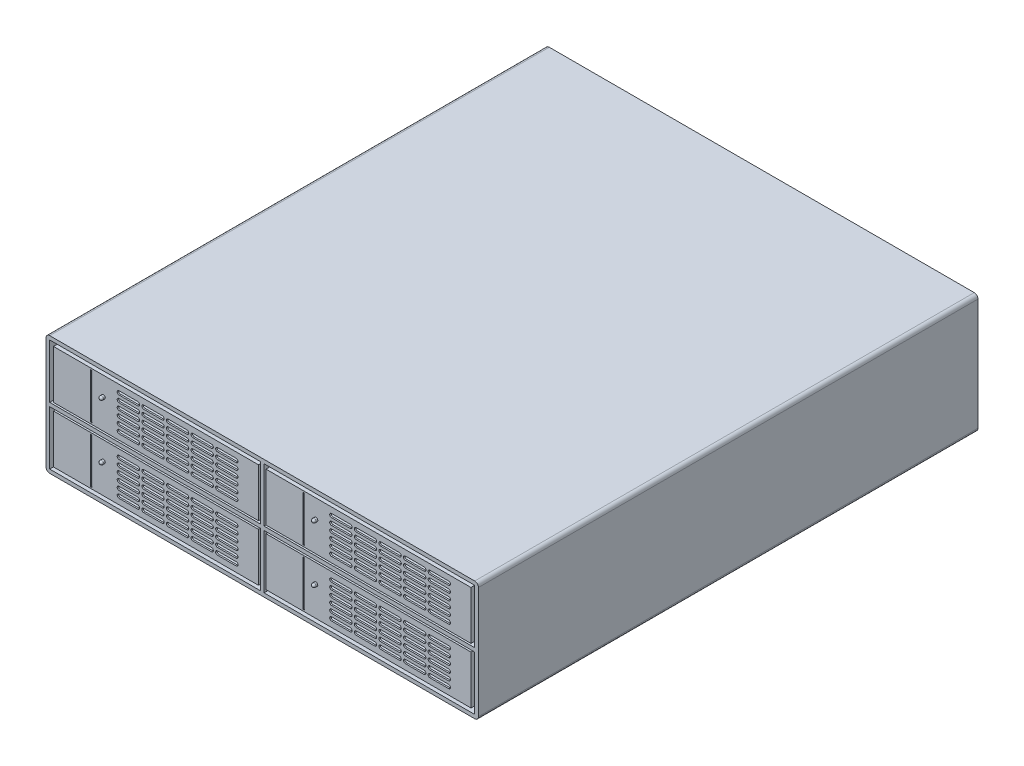
from build123d import *

# Parameters (mm, degrees)
SKETCH1_W           = 147.32
SKETCH1_H           = 40.64
BOSS_EXTRUDE1_DEPTH = 170.18
SKETCH2_W           = 71.755
SKETCH2_H           = 18.415
SKETCH2_W_2         = 69.85
SKETCH2_H_2         = 16.51
CUT_EXTRUDE1_DEPTH  = 152.4
FILLET1_R           = 1.27
CUT_EXTRUDE2_DEPTH  = 152.4
CUT_EXTRUDE3_START  = -0.508
SKETCH5_W           = 68.834
SKETCH5_H           = 15.494
CUT_EXTRUDE3_DEPTH  = 152.4
CUT_EXTRUDE4_START  = -0.508
SKETCH6_W           = 68.834
SKETCH6_H           = 15.494
CUT_EXTRUDE4_DEPTH  = 152.4
CUT_EXTRUDE5_START  = -0.508
SKETCH7_W           = 68.834
SKETCH7_H           = 15.494
CUT_EXTRUDE5_DEPTH  = 152.4
CUT_EXTRUDE6_START  = -0.508
SKETCH8_W           = 68.834
SKETCH8_H           = 15.494
CUT_EXTRUDE6_DEPTH  = 152.4
SKETCH9_W           = 0.508
SKETCH9_H           = 15.494
CUT_EXTRUDE7_DEPTH  = 0.254
SKETCH10_R          = 0.635
BOSS_EXTRUDE2_DEPTH = 1.27
FILLET3_R           = 0.635


with BuildPart() as part:
    # Sketch1 → Boss-Extrude1 (new body)
    with BuildSketch(Plane.XY):
        Rectangle(SKETCH1_W, SKETCH1_H)
    extrude(amount=-BOSS_EXTRUDE1_DEPTH)

    # Sketch2 → Cut-Extrude1 (cut)
    # profile 1 of 4: a face of its own
    with BuildSketch(Plane.XY):
        with Locations((-36.5125, 9.8425)):
            Rectangle(SKETCH2_W, SKETCH2_H)
        with Locations((-36.195, 9.525)):
            Rectangle(SKETCH2_W_2, SKETCH2_H_2, mode=Mode.SUBTRACT)
    # profile 2 of 4: a face of its own
    with BuildSketch(Plane.XY):
        with Locations((-36.5125, -9.8425)):
            Rectangle(SKETCH2_W, SKETCH2_H)
        with Locations((-36.195, -9.525)):
            Rectangle(SKETCH2_W_2, SKETCH2_H_2, mode=Mode.SUBTRACT)
    # profile 3 of 4: a face of its own
    with BuildSketch(Plane.XY):
        with Locations((36.5125, -9.8425)):
            Rectangle(SKETCH2_W, SKETCH2_H)
        with Locations((36.195, -9.525)):
            Rectangle(SKETCH2_W_2, SKETCH2_H_2, mode=Mode.SUBTRACT)
    # profile 4 of 4: a face of its own
    with BuildSketch(Plane.XY):
        with Locations((36.5125, 9.8425)):
            Rectangle(SKETCH2_W, SKETCH2_H)
        with Locations((36.195, 9.525)):
            Rectangle(SKETCH2_W_2, SKETCH2_H_2, mode=Mode.SUBTRACT)
    extrude(amount=-CUT_EXTRUDE1_DEPTH, mode=Mode.SUBTRACT)

    # Fillet1
    fillet1_edges = [part.edges().sort_by_distance(p)[0] for p in [
        (-73.66, 20.32, -85.09),
        (-73.66, -20.32, -85.09),
        (73.66, -20.32, -85.09),
        (73.66, 20.32, -85.09),
    ]]
    fillet(fillet1_edges, radius=FILLET1_R)

    # Sketch4 → Cut-Extrude2 (cut)
    with BuildSketch(Plane.XY):
        with BuildLine():
            Line((-8.89, 3.175), (-15.24, 3.175))
            ThreePointArc((-15.24, 3.175), (-15.875, 3.81), (-15.24, 4.445))
            Line((-15.24, 4.445), (-8.89, 4.445))
            ThreePointArc((-8.89, 4.445), (-8.255, 3.81), (-8.89, 3.175))
        make_face()
        with BuildLine():
            Line((-8.89, 5.461), (-15.24, 5.461))
            ThreePointArc((-15.24, 5.461), (-15.875, 6.096), (-15.24, 6.731))
            Line((-15.24, 6.731), (-8.89, 6.731))
            ThreePointArc((-8.89, 6.731), (-8.255, 6.096), (-8.89, 5.461))
        make_face()
        with BuildLine():
            Line((-8.89, 7.747), (-15.24, 7.747))
            ThreePointArc((-15.24, 7.747), (-15.875, 8.382), (-15.24, 9.017))
            Line((-15.24, 9.017), (-8.89, 9.017))
            ThreePointArc((-8.89, 9.017), (-8.255, 8.382), (-8.89, 7.747))
        make_face()
        with BuildLine():
            Line((-8.89, 10.033), (-15.24, 10.033))
            ThreePointArc((-15.24, 10.033), (-15.875, 10.668), (-15.24, 11.303))
            Line((-15.24, 11.303), (-8.89, 11.303))
            ThreePointArc((-8.89, 11.303), (-8.255, 10.668), (-8.89, 10.033))
        make_face()
        with BuildLine():
            Line((-8.89, 12.319), (-15.24, 12.319))
            ThreePointArc((-15.24, 12.319), (-15.875, 12.954), (-15.24, 13.589))
            Line((-15.24, 13.589), (-8.89, 13.589))
            ThreePointArc((-8.89, 13.589), (-8.255, 12.954), (-8.89, 12.319))
        make_face()
        with BuildLine():
            Line((-8.89, 14.605), (-15.24, 14.605))
            ThreePointArc((-15.24, 14.605), (-15.875, 15.24), (-15.24, 15.875))
            Line((-15.24, 15.875), (-8.89, 15.875))
            ThreePointArc((-8.89, 15.875), (-8.255, 15.24), (-8.89, 14.605))
        make_face()
        with BuildLine():
            Line((-17.272, 3.175), (-23.622, 3.175))
            ThreePointArc((-23.622, 3.175), (-24.257, 3.81), (-23.622, 4.445))
            Line((-23.622, 4.445), (-17.272, 4.445))
            ThreePointArc((-17.272, 4.445), (-16.637, 3.81), (-17.272, 3.175))
        make_face()
        with BuildLine():
            Line((-17.272, 5.461), (-23.622, 5.461))
            ThreePointArc((-23.622, 5.461), (-24.257, 6.096), (-23.622, 6.731))
            Line((-23.622, 6.731), (-17.272, 6.731))
            ThreePointArc((-17.272, 6.731), (-16.637, 6.096), (-17.272, 5.461))
        make_face()
        with BuildLine():
            Line((-17.272, 7.747), (-23.622, 7.747))
            ThreePointArc((-23.622, 7.747), (-24.257, 8.382), (-23.622, 9.017))
            Line((-23.622, 9.017), (-17.272, 9.017))
            ThreePointArc((-17.272, 9.017), (-16.637, 8.382), (-17.272, 7.747))
        make_face()
        with BuildLine():
            Line((-17.272, 10.033), (-23.622, 10.033))
            ThreePointArc((-23.622, 10.033), (-24.257, 10.668), (-23.622, 11.303))
            Line((-23.622, 11.303), (-17.272, 11.303))
            ThreePointArc((-17.272, 11.303), (-16.637, 10.668), (-17.272, 10.033))
        make_face()
        with BuildLine():
            Line((-17.272, 12.319), (-23.622, 12.319))
            ThreePointArc((-23.622, 12.319), (-24.257, 12.954), (-23.622, 13.589))
            Line((-23.622, 13.589), (-17.272, 13.589))
            ThreePointArc((-17.272, 13.589), (-16.637, 12.954), (-17.272, 12.319))
        make_face()
        with BuildLine():
            Line((-17.272, 14.605), (-23.622, 14.605))
            ThreePointArc((-23.622, 14.605), (-24.257, 15.24), (-23.622, 15.875))
            Line((-23.622, 15.875), (-17.272, 15.875))
            ThreePointArc((-17.272, 15.875), (-16.637, 15.24), (-17.272, 14.605))
        make_face()
        with BuildLine():
            Line((-25.654, 3.175), (-32.004, 3.175))
            ThreePointArc((-32.004, 3.175), (-32.639, 3.81), (-32.004, 4.445))
            Line((-32.004, 4.445), (-25.654, 4.445))
            ThreePointArc((-25.654, 4.445), (-25.019, 3.81), (-25.654, 3.175))
        make_face()
        with BuildLine():
            Line((-25.654, 5.461), (-32.004, 5.461))
            ThreePointArc((-32.004, 5.461), (-32.639, 6.096), (-32.004, 6.731))
            Line((-32.004, 6.731), (-25.654, 6.731))
            ThreePointArc((-25.654, 6.731), (-25.019, 6.096), (-25.654, 5.461))
        make_face()
        with BuildLine():
            Line((-25.654, 7.747), (-32.004, 7.747))
            ThreePointArc((-32.004, 7.747), (-32.639, 8.382), (-32.004, 9.017))
            Line((-32.004, 9.017), (-25.654, 9.017))
            ThreePointArc((-25.654, 9.017), (-25.019, 8.382), (-25.654, 7.747))
        make_face()
        with BuildLine():
            Line((-25.654, 10.033), (-32.004, 10.033))
            ThreePointArc((-32.004, 10.033), (-32.639, 10.668), (-32.004, 11.303))
            Line((-32.004, 11.303), (-25.654, 11.303))
            ThreePointArc((-25.654, 11.303), (-25.019, 10.668), (-25.654, 10.033))
        make_face()
        with BuildLine():
            Line((-25.654, 12.319), (-32.004, 12.319))
            ThreePointArc((-32.004, 12.319), (-32.639, 12.954), (-32.004, 13.589))
            Line((-32.004, 13.589), (-25.654, 13.589))
            ThreePointArc((-25.654, 13.589), (-25.019, 12.954), (-25.654, 12.319))
        make_face()
        with BuildLine():
            Line((-25.654, 14.605), (-32.004, 14.605))
            ThreePointArc((-32.004, 14.605), (-32.639, 15.24), (-32.004, 15.875))
            Line((-32.004, 15.875), (-25.654, 15.875))
            ThreePointArc((-25.654, 15.875), (-25.019, 15.24), (-25.654, 14.605))
        make_face()
        with BuildLine():
            Line((-34.036, 3.175), (-40.386, 3.175))
            ThreePointArc((-40.386, 3.175), (-41.021, 3.81), (-40.386, 4.445))
            Line((-40.386, 4.445), (-34.036, 4.445))
            ThreePointArc((-34.036, 4.445), (-33.401, 3.81), (-34.036, 3.175))
        make_face()
        with BuildLine():
            Line((-34.036, 5.461), (-40.386, 5.461))
            ThreePointArc((-40.386, 5.461), (-41.021, 6.096), (-40.386, 6.731))
            Line((-40.386, 6.731), (-34.036, 6.731))
            ThreePointArc((-34.036, 6.731), (-33.401, 6.096), (-34.036, 5.461))
        make_face()
        with BuildLine():
            Line((-34.036, 7.747), (-40.386, 7.747))
            ThreePointArc((-40.386, 7.747), (-41.021, 8.382), (-40.386, 9.017))
            Line((-40.386, 9.017), (-34.036, 9.017))
            ThreePointArc((-34.036, 9.017), (-33.401, 8.382), (-34.036, 7.747))
        make_face()
        with BuildLine():
            Line((-34.036, 10.033), (-40.386, 10.033))
            ThreePointArc((-40.386, 10.033), (-41.021, 10.668), (-40.386, 11.303))
            Line((-40.386, 11.303), (-34.036, 11.303))
            ThreePointArc((-34.036, 11.303), (-33.401, 10.668), (-34.036, 10.033))
        make_face()
        with BuildLine():
            Line((-34.036, 12.319), (-40.386, 12.319))
            ThreePointArc((-40.386, 12.319), (-41.021, 12.954), (-40.386, 13.589))
            Line((-40.386, 13.589), (-34.036, 13.589))
            ThreePointArc((-34.036, 13.589), (-33.401, 12.954), (-34.036, 12.319))
        make_face()
        with BuildLine():
            Line((-34.036, 14.605), (-40.386, 14.605))
            ThreePointArc((-40.386, 14.605), (-41.021, 15.24), (-40.386, 15.875))
            Line((-40.386, 15.875), (-34.036, 15.875))
            ThreePointArc((-34.036, 15.875), (-33.401, 15.24), (-34.036, 14.605))
        make_face()
        with BuildLine():
            Line((-42.418, 3.175), (-48.768, 3.175))
            ThreePointArc((-48.768, 3.175), (-49.403, 3.81), (-48.768, 4.445))
            Line((-48.768, 4.445), (-42.418, 4.445))
            ThreePointArc((-42.418, 4.445), (-41.783, 3.81), (-42.418, 3.175))
        make_face()
        with BuildLine():
            Line((-42.418, 5.461), (-48.768, 5.461))
            ThreePointArc((-48.768, 5.461), (-49.403, 6.096), (-48.768, 6.731))
            Line((-48.768, 6.731), (-42.418, 6.731))
            ThreePointArc((-42.418, 6.731), (-41.783, 6.096), (-42.418, 5.461))
        make_face()
        with BuildLine():
            Line((-42.418, 7.747), (-48.768, 7.747))
            ThreePointArc((-48.768, 7.747), (-49.403, 8.382), (-48.768, 9.017))
            Line((-48.768, 9.017), (-42.418, 9.017))
            ThreePointArc((-42.418, 9.017), (-41.783, 8.382), (-42.418, 7.747))
        make_face()
        with BuildLine():
            Line((-42.418, 10.033), (-48.768, 10.033))
            ThreePointArc((-48.768, 10.033), (-49.403, 10.668), (-48.768, 11.303))
            Line((-48.768, 11.303), (-42.418, 11.303))
            ThreePointArc((-42.418, 11.303), (-41.783, 10.668), (-42.418, 10.033))
        make_face()
        with BuildLine():
            Line((-42.418, 12.319), (-48.768, 12.319))
            ThreePointArc((-48.768, 12.319), (-49.403, 12.954), (-48.768, 13.589))
            Line((-48.768, 13.589), (-42.418, 13.589))
            ThreePointArc((-42.418, 13.589), (-41.783, 12.954), (-42.418, 12.319))
        make_face()
        with BuildLine():
            Line((-42.418, 14.605), (-48.768, 14.605))
            ThreePointArc((-48.768, 14.605), (-49.403, 15.24), (-48.768, 15.875))
            Line((-48.768, 15.875), (-42.418, 15.875))
            ThreePointArc((-42.418, 15.875), (-41.783, 15.24), (-42.418, 14.605))
        make_face()
        with BuildLine():
            Line((-42.418, -14.605), (-48.768, -14.605))
            ThreePointArc((-48.768, -14.605), (-49.403, -15.24), (-48.768, -15.875))
            Line((-48.768, -15.875), (-42.418, -15.875))
            ThreePointArc((-42.418, -15.875), (-41.783, -15.24), (-42.418, -14.605))
        make_face()
        with BuildLine():
            Line((-42.418, -12.319), (-48.768, -12.319))
            ThreePointArc((-48.768, -12.319), (-49.403, -12.954), (-48.768, -13.589))
            Line((-48.768, -13.589), (-42.418, -13.589))
            ThreePointArc((-42.418, -13.589), (-41.783, -12.954), (-42.418, -12.319))
        make_face()
        with BuildLine():
            Line((-42.418, -10.033), (-48.768, -10.033))
            ThreePointArc((-48.768, -10.033), (-49.403, -10.668), (-48.768, -11.303))
            Line((-48.768, -11.303), (-42.418, -11.303))
            ThreePointArc((-42.418, -11.303), (-41.783, -10.668), (-42.418, -10.033))
        make_face()
        with BuildLine():
            Line((-42.418, -7.747), (-48.768, -7.747))
            ThreePointArc((-48.768, -7.747), (-49.403, -8.382), (-48.768, -9.017))
            Line((-48.768, -9.017), (-42.418, -9.017))
            ThreePointArc((-42.418, -9.017), (-41.783, -8.382), (-42.418, -7.747))
        make_face()
        with BuildLine():
            Line((-42.418, -5.461), (-48.768, -5.461))
            ThreePointArc((-48.768, -5.461), (-49.403, -6.096), (-48.768, -6.731))
            Line((-48.768, -6.731), (-42.418, -6.731))
            ThreePointArc((-42.418, -6.731), (-41.783, -6.096), (-42.418, -5.461))
        make_face()
        with BuildLine():
            Line((-42.418, -3.175), (-48.768, -3.175))
            ThreePointArc((-48.768, -3.175), (-49.403, -3.81), (-48.768, -4.445))
            Line((-48.768, -4.445), (-42.418, -4.445))
            ThreePointArc((-42.418, -4.445), (-41.783, -3.81), (-42.418, -3.175))
        make_face()
        with BuildLine():
            Line((-34.036, -14.605), (-40.386, -14.605))
            ThreePointArc((-40.386, -14.605), (-41.021, -15.24), (-40.386, -15.875))
            Line((-40.386, -15.875), (-34.036, -15.875))
            ThreePointArc((-34.036, -15.875), (-33.401, -15.24), (-34.036, -14.605))
        make_face()
        with BuildLine():
            Line((-34.036, -12.319), (-40.386, -12.319))
            ThreePointArc((-40.386, -12.319), (-41.021, -12.954), (-40.386, -13.589))
            Line((-40.386, -13.589), (-34.036, -13.589))
            ThreePointArc((-34.036, -13.589), (-33.401, -12.954), (-34.036, -12.319))
        make_face()
        with BuildLine():
            Line((-34.036, -10.033), (-40.386, -10.033))
            ThreePointArc((-40.386, -10.033), (-41.021, -10.668), (-40.386, -11.303))
            Line((-40.386, -11.303), (-34.036, -11.303))
            ThreePointArc((-34.036, -11.303), (-33.401, -10.668), (-34.036, -10.033))
        make_face()
        with BuildLine():
            Line((-34.036, -7.747), (-40.386, -7.747))
            ThreePointArc((-40.386, -7.747), (-41.021, -8.382), (-40.386, -9.017))
            Line((-40.386, -9.017), (-34.036, -9.017))
            ThreePointArc((-34.036, -9.017), (-33.401, -8.382), (-34.036, -7.747))
        make_face()
        with BuildLine():
            Line((-34.036, -5.461), (-40.386, -5.461))
            ThreePointArc((-40.386, -5.461), (-41.021, -6.096), (-40.386, -6.731))
            Line((-40.386, -6.731), (-34.036, -6.731))
            ThreePointArc((-34.036, -6.731), (-33.401, -6.096), (-34.036, -5.461))
        make_face()
        with BuildLine():
            Line((-34.036, -3.175), (-40.386, -3.175))
            ThreePointArc((-40.386, -3.175), (-41.021, -3.81), (-40.386, -4.445))
            Line((-40.386, -4.445), (-34.036, -4.445))
            ThreePointArc((-34.036, -4.445), (-33.401, -3.81), (-34.036, -3.175))
        make_face()
        with BuildLine():
            Line((-25.654, -14.605), (-32.004, -14.605))
            ThreePointArc((-32.004, -14.605), (-32.639, -15.24), (-32.004, -15.875))
            Line((-32.004, -15.875), (-25.654, -15.875))
            ThreePointArc((-25.654, -15.875), (-25.019, -15.24), (-25.654, -14.605))
        make_face()
        with BuildLine():
            Line((-25.654, -12.319), (-32.004, -12.319))
            ThreePointArc((-32.004, -12.319), (-32.639, -12.954), (-32.004, -13.589))
            Line((-32.004, -13.589), (-25.654, -13.589))
            ThreePointArc((-25.654, -13.589), (-25.019, -12.954), (-25.654, -12.319))
        make_face()
        with BuildLine():
            Line((-25.654, -10.033), (-32.004, -10.033))
            ThreePointArc((-32.004, -10.033), (-32.639, -10.668), (-32.004, -11.303))
            Line((-32.004, -11.303), (-25.654, -11.303))
            ThreePointArc((-25.654, -11.303), (-25.019, -10.668), (-25.654, -10.033))
        make_face()
        with BuildLine():
            Line((-25.654, -7.747), (-32.004, -7.747))
            ThreePointArc((-32.004, -7.747), (-32.639, -8.382), (-32.004, -9.017))
            Line((-32.004, -9.017), (-25.654, -9.017))
            ThreePointArc((-25.654, -9.017), (-25.019, -8.382), (-25.654, -7.747))
        make_face()
        with BuildLine():
            Line((-25.654, -5.461), (-32.004, -5.461))
            ThreePointArc((-32.004, -5.461), (-32.639, -6.096), (-32.004, -6.731))
            Line((-32.004, -6.731), (-25.654, -6.731))
            ThreePointArc((-25.654, -6.731), (-25.019, -6.096), (-25.654, -5.461))
        make_face()
        with BuildLine():
            Line((-25.654, -3.175), (-32.004, -3.175))
            ThreePointArc((-32.004, -3.175), (-32.639, -3.81), (-32.004, -4.445))
            Line((-32.004, -4.445), (-25.654, -4.445))
            ThreePointArc((-25.654, -4.445), (-25.019, -3.81), (-25.654, -3.175))
        make_face()
        with BuildLine():
            Line((-17.272, -14.605), (-23.622, -14.605))
            ThreePointArc((-23.622, -14.605), (-24.257, -15.24), (-23.622, -15.875))
            Line((-23.622, -15.875), (-17.272, -15.875))
            ThreePointArc((-17.272, -15.875), (-16.637, -15.24), (-17.272, -14.605))
        make_face()
        with BuildLine():
            Line((-17.272, -12.319), (-23.622, -12.319))
            ThreePointArc((-23.622, -12.319), (-24.257, -12.954), (-23.622, -13.589))
            Line((-23.622, -13.589), (-17.272, -13.589))
            ThreePointArc((-17.272, -13.589), (-16.637, -12.954), (-17.272, -12.319))
        make_face()
        with BuildLine():
            Line((-17.272, -10.033), (-23.622, -10.033))
            ThreePointArc((-23.622, -10.033), (-24.257, -10.668), (-23.622, -11.303))
            Line((-23.622, -11.303), (-17.272, -11.303))
            ThreePointArc((-17.272, -11.303), (-16.637, -10.668), (-17.272, -10.033))
        make_face()
        with BuildLine():
            Line((-17.272, -7.747), (-23.622, -7.747))
            ThreePointArc((-23.622, -7.747), (-24.257, -8.382), (-23.622, -9.017))
            Line((-23.622, -9.017), (-17.272, -9.017))
            ThreePointArc((-17.272, -9.017), (-16.637, -8.382), (-17.272, -7.747))
        make_face()
        with BuildLine():
            Line((-17.272, -5.461), (-23.622, -5.461))
            ThreePointArc((-23.622, -5.461), (-24.257, -6.096), (-23.622, -6.731))
            Line((-23.622, -6.731), (-17.272, -6.731))
            ThreePointArc((-17.272, -6.731), (-16.637, -6.096), (-17.272, -5.461))
        make_face()
        with BuildLine():
            Line((-17.272, -3.175), (-23.622, -3.175))
            ThreePointArc((-23.622, -3.175), (-24.257, -3.81), (-23.622, -4.445))
            Line((-23.622, -4.445), (-17.272, -4.445))
            ThreePointArc((-17.272, -4.445), (-16.637, -3.81), (-17.272, -3.175))
        make_face()
        with BuildLine():
            Line((-8.89, -14.605), (-15.24, -14.605))
            ThreePointArc((-15.24, -14.605), (-15.875, -15.24), (-15.24, -15.875))
            Line((-15.24, -15.875), (-8.89, -15.875))
            ThreePointArc((-8.89, -15.875), (-8.255, -15.24), (-8.89, -14.605))
        make_face()
        with BuildLine():
            Line((-8.89, -12.319), (-15.24, -12.319))
            ThreePointArc((-15.24, -12.319), (-15.875, -12.954), (-15.24, -13.589))
            Line((-15.24, -13.589), (-8.89, -13.589))
            ThreePointArc((-8.89, -13.589), (-8.255, -12.954), (-8.89, -12.319))
        make_face()
        with BuildLine():
            Line((-8.89, -10.033), (-15.24, -10.033))
            ThreePointArc((-15.24, -10.033), (-15.875, -10.668), (-15.24, -11.303))
            Line((-15.24, -11.303), (-8.89, -11.303))
            ThreePointArc((-8.89, -11.303), (-8.255, -10.668), (-8.89, -10.033))
        make_face()
        with BuildLine():
            Line((-8.89, -7.747), (-15.24, -7.747))
            ThreePointArc((-15.24, -7.747), (-15.875, -8.382), (-15.24, -9.017))
            Line((-15.24, -9.017), (-8.89, -9.017))
            ThreePointArc((-8.89, -9.017), (-8.255, -8.382), (-8.89, -7.747))
        make_face()
        with BuildLine():
            Line((-8.89, -5.461), (-15.24, -5.461))
            ThreePointArc((-15.24, -5.461), (-15.875, -6.096), (-15.24, -6.731))
            Line((-15.24, -6.731), (-8.89, -6.731))
            ThreePointArc((-8.89, -6.731), (-8.255, -6.096), (-8.89, -5.461))
        make_face()
        with BuildLine():
            Line((-8.89, -3.175), (-15.24, -3.175))
            ThreePointArc((-15.24, -3.175), (-15.875, -3.81), (-15.24, -4.445))
            Line((-15.24, -4.445), (-8.89, -4.445))
            ThreePointArc((-8.89, -4.445), (-8.255, -3.81), (-8.89, -3.175))
        make_face()
        with BuildLine():
            Line((63.5, 3.175), (57.15, 3.175))
            ThreePointArc((57.15, 3.175), (56.515, 3.81), (57.15, 4.445))
            Line((57.15, 4.445), (63.5, 4.445))
            ThreePointArc((63.5, 4.445), (64.135, 3.81), (63.5, 3.175))
        make_face()
        with BuildLine():
            Line((63.5, 5.461), (57.15, 5.461))
            ThreePointArc((57.15, 5.461), (56.515, 6.096), (57.15, 6.731))
            Line((57.15, 6.731), (63.5, 6.731))
            ThreePointArc((63.5, 6.731), (64.135, 6.096), (63.5, 5.461))
        make_face()
        with BuildLine():
            Line((63.5, 7.747), (57.15, 7.747))
            ThreePointArc((57.15, 7.747), (56.515, 8.382), (57.15, 9.017))
            Line((57.15, 9.017), (63.5, 9.017))
            ThreePointArc((63.5, 9.017), (64.135, 8.382), (63.5, 7.747))
        make_face()
        with BuildLine():
            Line((63.5, 10.033), (57.15, 10.033))
            ThreePointArc((57.15, 10.033), (56.515, 10.668), (57.15, 11.303))
            Line((57.15, 11.303), (63.5, 11.303))
            ThreePointArc((63.5, 11.303), (64.135, 10.668), (63.5, 10.033))
        make_face()
        with BuildLine():
            Line((63.5, 12.319), (57.15, 12.319))
            ThreePointArc((57.15, 12.319), (56.515, 12.954), (57.15, 13.589))
            Line((57.15, 13.589), (63.5, 13.589))
            ThreePointArc((63.5, 13.589), (64.135, 12.954), (63.5, 12.319))
        make_face()
        with BuildLine():
            Line((63.5, 14.605), (57.15, 14.605))
            ThreePointArc((57.15, 14.605), (56.515, 15.24), (57.15, 15.875))
            Line((57.15, 15.875), (63.5, 15.875))
            ThreePointArc((63.5, 15.875), (64.135, 15.24), (63.5, 14.605))
        make_face()
        with BuildLine():
            Line((55.118, 3.175), (48.768, 3.175))
            ThreePointArc((48.768, 3.175), (48.133, 3.81), (48.768, 4.445))
            Line((48.768, 4.445), (55.118, 4.445))
            ThreePointArc((55.118, 4.445), (55.753, 3.81), (55.118, 3.175))
        make_face()
        with BuildLine():
            Line((55.118, 5.461), (48.768, 5.461))
            ThreePointArc((48.768, 5.461), (48.133, 6.096), (48.768, 6.731))
            Line((48.768, 6.731), (55.118, 6.731))
            ThreePointArc((55.118, 6.731), (55.753, 6.096), (55.118, 5.461))
        make_face()
        with BuildLine():
            Line((55.118, 7.747), (48.768, 7.747))
            ThreePointArc((48.768, 7.747), (48.133, 8.382), (48.768, 9.017))
            Line((48.768, 9.017), (55.118, 9.017))
            ThreePointArc((55.118, 9.017), (55.753, 8.382), (55.118, 7.747))
        make_face()
        with BuildLine():
            Line((55.118, 10.033), (48.768, 10.033))
            ThreePointArc((48.768, 10.033), (48.133, 10.668), (48.768, 11.303))
            Line((48.768, 11.303), (55.118, 11.303))
            ThreePointArc((55.118, 11.303), (55.753, 10.668), (55.118, 10.033))
        make_face()
        with BuildLine():
            Line((55.118, 12.319), (48.768, 12.319))
            ThreePointArc((48.768, 12.319), (48.133, 12.954), (48.768, 13.589))
            Line((48.768, 13.589), (55.118, 13.589))
            ThreePointArc((55.118, 13.589), (55.753, 12.954), (55.118, 12.319))
        make_face()
        with BuildLine():
            Line((55.118, 14.605), (48.768, 14.605))
            ThreePointArc((48.768, 14.605), (48.133, 15.24), (48.768, 15.875))
            Line((48.768, 15.875), (55.118, 15.875))
            ThreePointArc((55.118, 15.875), (55.753, 15.24), (55.118, 14.605))
        make_face()
        with BuildLine():
            Line((46.736, 3.175), (40.386, 3.175))
            ThreePointArc((40.386, 3.175), (39.751, 3.81), (40.386, 4.445))
            Line((40.386, 4.445), (46.736, 4.445))
            ThreePointArc((46.736, 4.445), (47.371, 3.81), (46.736, 3.175))
        make_face()
        with BuildLine():
            Line((46.736, 5.461), (40.386, 5.461))
            ThreePointArc((40.386, 5.461), (39.751, 6.096), (40.386, 6.731))
            Line((40.386, 6.731), (46.736, 6.731))
            ThreePointArc((46.736, 6.731), (47.371, 6.096), (46.736, 5.461))
        make_face()
        with BuildLine():
            Line((46.736, 7.747), (40.386, 7.747))
            ThreePointArc((40.386, 7.747), (39.751, 8.382), (40.386, 9.017))
            Line((40.386, 9.017), (46.736, 9.017))
            ThreePointArc((46.736, 9.017), (47.371, 8.382), (46.736, 7.747))
        make_face()
        with BuildLine():
            Line((46.736, 10.033), (40.386, 10.033))
            ThreePointArc((40.386, 10.033), (39.751, 10.668), (40.386, 11.303))
            Line((40.386, 11.303), (46.736, 11.303))
            ThreePointArc((46.736, 11.303), (47.371, 10.668), (46.736, 10.033))
        make_face()
        with BuildLine():
            Line((46.736, 12.319), (40.386, 12.319))
            ThreePointArc((40.386, 12.319), (39.751, 12.954), (40.386, 13.589))
            Line((40.386, 13.589), (46.736, 13.589))
            ThreePointArc((46.736, 13.589), (47.371, 12.954), (46.736, 12.319))
        make_face()
        with BuildLine():
            Line((46.736, 14.605), (40.386, 14.605))
            ThreePointArc((40.386, 14.605), (39.751, 15.24), (40.386, 15.875))
            Line((40.386, 15.875), (46.736, 15.875))
            ThreePointArc((46.736, 15.875), (47.371, 15.24), (46.736, 14.605))
        make_face()
        with BuildLine():
            Line((38.354, 3.175), (32.004, 3.175))
            ThreePointArc((32.004, 3.175), (31.369, 3.81), (32.004, 4.445))
            Line((32.004, 4.445), (38.354, 4.445))
            ThreePointArc((38.354, 4.445), (38.989, 3.81), (38.354, 3.175))
        make_face()
        with BuildLine():
            Line((38.354, 5.461), (32.004, 5.461))
            ThreePointArc((32.004, 5.461), (31.369, 6.096), (32.004, 6.731))
            Line((32.004, 6.731), (38.354, 6.731))
            ThreePointArc((38.354, 6.731), (38.989, 6.096), (38.354, 5.461))
        make_face()
        with BuildLine():
            Line((38.354, 7.747), (32.004, 7.747))
            ThreePointArc((32.004, 7.747), (31.369, 8.382), (32.004, 9.017))
            Line((32.004, 9.017), (38.354, 9.017))
            ThreePointArc((38.354, 9.017), (38.989, 8.382), (38.354, 7.747))
        make_face()
        with BuildLine():
            Line((38.354, 10.033), (32.004, 10.033))
            ThreePointArc((32.004, 10.033), (31.369, 10.668), (32.004, 11.303))
            Line((32.004, 11.303), (38.354, 11.303))
            ThreePointArc((38.354, 11.303), (38.989, 10.668), (38.354, 10.033))
        make_face()
        with BuildLine():
            Line((38.354, 12.319), (32.004, 12.319))
            ThreePointArc((32.004, 12.319), (31.369, 12.954), (32.004, 13.589))
            Line((32.004, 13.589), (38.354, 13.589))
            ThreePointArc((38.354, 13.589), (38.989, 12.954), (38.354, 12.319))
        make_face()
        with BuildLine():
            Line((38.354, 14.605), (32.004, 14.605))
            ThreePointArc((32.004, 14.605), (31.369, 15.24), (32.004, 15.875))
            Line((32.004, 15.875), (38.354, 15.875))
            ThreePointArc((38.354, 15.875), (38.989, 15.24), (38.354, 14.605))
        make_face()
        with BuildLine():
            Line((29.972, 3.175), (23.622, 3.175))
            ThreePointArc((23.622, 3.175), (22.987, 3.81), (23.622, 4.445))
            Line((23.622, 4.445), (29.972, 4.445))
            ThreePointArc((29.972, 4.445), (30.607, 3.81), (29.972, 3.175))
        make_face()
        with BuildLine():
            Line((29.972, 5.461), (23.622, 5.461))
            ThreePointArc((23.622, 5.461), (22.987, 6.096), (23.622, 6.731))
            Line((23.622, 6.731), (29.972, 6.731))
            ThreePointArc((29.972, 6.731), (30.607, 6.096), (29.972, 5.461))
        make_face()
        with BuildLine():
            Line((29.972, 7.747), (23.622, 7.747))
            ThreePointArc((23.622, 7.747), (22.987, 8.382), (23.622, 9.017))
            Line((23.622, 9.017), (29.972, 9.017))
            ThreePointArc((29.972, 9.017), (30.607, 8.382), (29.972, 7.747))
        make_face()
        with BuildLine():
            Line((29.972, 10.033), (23.622, 10.033))
            ThreePointArc((23.622, 10.033), (22.987, 10.668), (23.622, 11.303))
            Line((23.622, 11.303), (29.972, 11.303))
            ThreePointArc((29.972, 11.303), (30.607, 10.668), (29.972, 10.033))
        make_face()
        with BuildLine():
            Line((29.972, 12.319), (23.622, 12.319))
            ThreePointArc((23.622, 12.319), (22.987, 12.954), (23.622, 13.589))
            Line((23.622, 13.589), (29.972, 13.589))
            ThreePointArc((29.972, 13.589), (30.607, 12.954), (29.972, 12.319))
        make_face()
        with BuildLine():
            Line((29.972, 14.605), (23.622, 14.605))
            ThreePointArc((23.622, 14.605), (22.987, 15.24), (23.622, 15.875))
            Line((23.622, 15.875), (29.972, 15.875))
            ThreePointArc((29.972, 15.875), (30.607, 15.24), (29.972, 14.605))
        make_face()
        with BuildLine():
            Line((29.972, -14.605), (23.622, -14.605))
            ThreePointArc((23.622, -14.605), (22.987, -15.24), (23.622, -15.875))
            Line((23.622, -15.875), (29.972, -15.875))
            ThreePointArc((29.972, -15.875), (30.607, -15.24), (29.972, -14.605))
        make_face()
        with BuildLine():
            Line((29.972, -12.319), (23.622, -12.319))
            ThreePointArc((23.622, -12.319), (22.987, -12.954), (23.622, -13.589))
            Line((23.622, -13.589), (29.972, -13.589))
            ThreePointArc((29.972, -13.589), (30.607, -12.954), (29.972, -12.319))
        make_face()
        with BuildLine():
            Line((29.972, -10.033), (23.622, -10.033))
            ThreePointArc((23.622, -10.033), (22.987, -10.668), (23.622, -11.303))
            Line((23.622, -11.303), (29.972, -11.303))
            ThreePointArc((29.972, -11.303), (30.607, -10.668), (29.972, -10.033))
        make_face()
        with BuildLine():
            Line((29.972, -7.747), (23.622, -7.747))
            ThreePointArc((23.622, -7.747), (22.987, -8.382), (23.622, -9.017))
            Line((23.622, -9.017), (29.972, -9.017))
            ThreePointArc((29.972, -9.017), (30.607, -8.382), (29.972, -7.747))
        make_face()
        with BuildLine():
            Line((29.972, -5.461), (23.622, -5.461))
            ThreePointArc((23.622, -5.461), (22.987, -6.096), (23.622, -6.731))
            Line((23.622, -6.731), (29.972, -6.731))
            ThreePointArc((29.972, -6.731), (30.607, -6.096), (29.972, -5.461))
        make_face()
        with BuildLine():
            Line((29.972, -3.175), (23.622, -3.175))
            ThreePointArc((23.622, -3.175), (22.987, -3.81), (23.622, -4.445))
            Line((23.622, -4.445), (29.972, -4.445))
            ThreePointArc((29.972, -4.445), (30.607, -3.81), (29.972, -3.175))
        make_face()
        with BuildLine():
            Line((38.354, -14.605), (32.004, -14.605))
            ThreePointArc((32.004, -14.605), (31.369, -15.24), (32.004, -15.875))
            Line((32.004, -15.875), (38.354, -15.875))
            ThreePointArc((38.354, -15.875), (38.989, -15.24), (38.354, -14.605))
        make_face()
        with BuildLine():
            Line((38.354, -12.319), (32.004, -12.319))
            ThreePointArc((32.004, -12.319), (31.369, -12.954), (32.004, -13.589))
            Line((32.004, -13.589), (38.354, -13.589))
            ThreePointArc((38.354, -13.589), (38.989, -12.954), (38.354, -12.319))
        make_face()
        with BuildLine():
            Line((38.354, -10.033), (32.004, -10.033))
            ThreePointArc((32.004, -10.033), (31.369, -10.668), (32.004, -11.303))
            Line((32.004, -11.303), (38.354, -11.303))
            ThreePointArc((38.354, -11.303), (38.989, -10.668), (38.354, -10.033))
        make_face()
        with BuildLine():
            Line((38.354, -7.747), (32.004, -7.747))
            ThreePointArc((32.004, -7.747), (31.369, -8.382), (32.004, -9.017))
            Line((32.004, -9.017), (38.354, -9.017))
            ThreePointArc((38.354, -9.017), (38.989, -8.382), (38.354, -7.747))
        make_face()
        with BuildLine():
            Line((38.354, -5.461), (32.004, -5.461))
            ThreePointArc((32.004, -5.461), (31.369, -6.096), (32.004, -6.731))
            Line((32.004, -6.731), (38.354, -6.731))
            ThreePointArc((38.354, -6.731), (38.989, -6.096), (38.354, -5.461))
        make_face()
        with BuildLine():
            Line((38.354, -3.175), (32.004, -3.175))
            ThreePointArc((32.004, -3.175), (31.369, -3.81), (32.004, -4.445))
            Line((32.004, -4.445), (38.354, -4.445))
            ThreePointArc((38.354, -4.445), (38.989, -3.81), (38.354, -3.175))
        make_face()
        with BuildLine():
            Line((46.736, -14.605), (40.386, -14.605))
            ThreePointArc((40.386, -14.605), (39.751, -15.24), (40.386, -15.875))
            Line((40.386, -15.875), (46.736, -15.875))
            ThreePointArc((46.736, -15.875), (47.371, -15.24), (46.736, -14.605))
        make_face()
        with BuildLine():
            Line((46.736, -12.319), (40.386, -12.319))
            ThreePointArc((40.386, -12.319), (39.751, -12.954), (40.386, -13.589))
            Line((40.386, -13.589), (46.736, -13.589))
            ThreePointArc((46.736, -13.589), (47.371, -12.954), (46.736, -12.319))
        make_face()
        with BuildLine():
            Line((46.736, -10.033), (40.386, -10.033))
            ThreePointArc((40.386, -10.033), (39.751, -10.668), (40.386, -11.303))
            Line((40.386, -11.303), (46.736, -11.303))
            ThreePointArc((46.736, -11.303), (47.371, -10.668), (46.736, -10.033))
        make_face()
        with BuildLine():
            Line((46.736, -7.747), (40.386, -7.747))
            ThreePointArc((40.386, -7.747), (39.751, -8.382), (40.386, -9.017))
            Line((40.386, -9.017), (46.736, -9.017))
            ThreePointArc((46.736, -9.017), (47.371, -8.382), (46.736, -7.747))
        make_face()
        with BuildLine():
            Line((46.736, -5.461), (40.386, -5.461))
            ThreePointArc((40.386, -5.461), (39.751, -6.096), (40.386, -6.731))
            Line((40.386, -6.731), (46.736, -6.731))
            ThreePointArc((46.736, -6.731), (47.371, -6.096), (46.736, -5.461))
        make_face()
        with BuildLine():
            Line((46.736, -3.175), (40.386, -3.175))
            ThreePointArc((40.386, -3.175), (39.751, -3.81), (40.386, -4.445))
            Line((40.386, -4.445), (46.736, -4.445))
            ThreePointArc((46.736, -4.445), (47.371, -3.81), (46.736, -3.175))
        make_face()
        with BuildLine():
            Line((55.118, -14.605), (48.768, -14.605))
            ThreePointArc((48.768, -14.605), (48.133, -15.24), (48.768, -15.875))
            Line((48.768, -15.875), (55.118, -15.875))
            ThreePointArc((55.118, -15.875), (55.753, -15.24), (55.118, -14.605))
        make_face()
        with BuildLine():
            Line((55.118, -12.319), (48.768, -12.319))
            ThreePointArc((48.768, -12.319), (48.133, -12.954), (48.768, -13.589))
            Line((48.768, -13.589), (55.118, -13.589))
            ThreePointArc((55.118, -13.589), (55.753, -12.954), (55.118, -12.319))
        make_face()
        with BuildLine():
            Line((55.118, -10.033), (48.768, -10.033))
            ThreePointArc((48.768, -10.033), (48.133, -10.668), (48.768, -11.303))
            Line((48.768, -11.303), (55.118, -11.303))
            ThreePointArc((55.118, -11.303), (55.753, -10.668), (55.118, -10.033))
        make_face()
        with BuildLine():
            Line((55.118, -7.747), (48.768, -7.747))
            ThreePointArc((48.768, -7.747), (48.133, -8.382), (48.768, -9.017))
            Line((48.768, -9.017), (55.118, -9.017))
            ThreePointArc((55.118, -9.017), (55.753, -8.382), (55.118, -7.747))
        make_face()
        with BuildLine():
            Line((55.118, -5.461), (48.768, -5.461))
            ThreePointArc((48.768, -5.461), (48.133, -6.096), (48.768, -6.731))
            Line((48.768, -6.731), (55.118, -6.731))
            ThreePointArc((55.118, -6.731), (55.753, -6.096), (55.118, -5.461))
        make_face()
        with BuildLine():
            Line((55.118, -3.175), (48.768, -3.175))
            ThreePointArc((48.768, -3.175), (48.133, -3.81), (48.768, -4.445))
            Line((48.768, -4.445), (55.118, -4.445))
            ThreePointArc((55.118, -4.445), (55.753, -3.81), (55.118, -3.175))
        make_face()
        with BuildLine():
            Line((63.5, -14.605), (57.15, -14.605))
            ThreePointArc((57.15, -14.605), (56.515, -15.24), (57.15, -15.875))
            Line((57.15, -15.875), (63.5, -15.875))
            ThreePointArc((63.5, -15.875), (64.135, -15.24), (63.5, -14.605))
        make_face()
        with BuildLine():
            Line((63.5, -12.319), (57.15, -12.319))
            ThreePointArc((57.15, -12.319), (56.515, -12.954), (57.15, -13.589))
            Line((57.15, -13.589), (63.5, -13.589))
            ThreePointArc((63.5, -13.589), (64.135, -12.954), (63.5, -12.319))
        make_face()
        with BuildLine():
            Line((63.5, -10.033), (57.15, -10.033))
            ThreePointArc((57.15, -10.033), (56.515, -10.668), (57.15, -11.303))
            Line((57.15, -11.303), (63.5, -11.303))
            ThreePointArc((63.5, -11.303), (64.135, -10.668), (63.5, -10.033))
        make_face()
        with BuildLine():
            Line((63.5, -7.747), (57.15, -7.747))
            ThreePointArc((57.15, -7.747), (56.515, -8.382), (57.15, -9.017))
            Line((57.15, -9.017), (63.5, -9.017))
            ThreePointArc((63.5, -9.017), (64.135, -8.382), (63.5, -7.747))
        make_face()
        with BuildLine():
            Line((63.5, -5.461), (57.15, -5.461))
            ThreePointArc((57.15, -5.461), (56.515, -6.096), (57.15, -6.731))
            Line((57.15, -6.731), (63.5, -6.731))
            ThreePointArc((63.5, -6.731), (64.135, -6.096), (63.5, -5.461))
        make_face()
        with BuildLine():
            Line((63.5, -3.175), (57.15, -3.175))
            ThreePointArc((57.15, -3.175), (56.515, -3.81), (57.15, -4.445))
            Line((57.15, -4.445), (63.5, -4.445))
            ThreePointArc((63.5, -4.445), (64.135, -3.81), (63.5, -3.175))
        make_face()
    extrude(amount=-CUT_EXTRUDE2_DEPTH, mode=Mode.SUBTRACT)

    # Sketch5 → Cut-Extrude3 (cut)
    with BuildSketch(Plane.XY.offset(CUT_EXTRUDE3_START)):
        with Locations((-36.195, 9.525)):
            Rectangle(SKETCH5_W, SKETCH5_H)
    extrude(amount=-CUT_EXTRUDE3_DEPTH, mode=Mode.SUBTRACT)

    # Sketch6 → Cut-Extrude4 (cut)
    with BuildSketch(Plane.XY.offset(CUT_EXTRUDE4_START)):
        with Locations((36.195, 9.525)):
            Rectangle(SKETCH6_W, SKETCH6_H)
    extrude(amount=-CUT_EXTRUDE4_DEPTH, mode=Mode.SUBTRACT)

    # Sketch7 → Cut-Extrude5 (cut)
    with BuildSketch(Plane.XY.offset(CUT_EXTRUDE5_START)):
        with Locations((-36.195, -9.525)):
            Rectangle(SKETCH7_W, SKETCH7_H)
    extrude(amount=-CUT_EXTRUDE5_DEPTH, mode=Mode.SUBTRACT)

    # Sketch8 → Cut-Extrude6 (cut)
    with BuildSketch(Plane.XY.offset(CUT_EXTRUDE6_START)):
        with Locations((36.195, -9.525)):
            Rectangle(SKETCH8_W, SKETCH8_H)
    extrude(amount=-CUT_EXTRUDE6_DEPTH, mode=Mode.SUBTRACT)

    # Sketch9 → Cut-Extrude7 (cut)
    with BuildSketch(Plane.XY):
        with Locations((-58.166, 9.525)):
            Rectangle(SKETCH9_W, SKETCH9_H)
        with Locations((14.224, 9.525)):
            Rectangle(SKETCH9_W, SKETCH9_H)
        with Locations((14.224, -9.525)):
            Rectangle(SKETCH9_W, SKETCH9_H)
        with Locations((-58.166, -9.525)):
            Rectangle(SKETCH9_W, SKETCH9_H)
    extrude(amount=-CUT_EXTRUDE7_DEPTH, mode=Mode.SUBTRACT)

    # Sketch10 → Boss-Extrude2 (add)
    with BuildSketch(Plane.XY):
        with Locations((-54.102, 11.43)):
            Circle(SKETCH10_R)
        with Locations((18.288, 11.43)):
            Circle(SKETCH10_R)
        with Locations((18.288, -7.62)):
            Circle(SKETCH10_R)
        with Locations((-54.102, -7.62)):
            Circle(SKETCH10_R)
    extrude(amount=BOSS_EXTRUDE2_DEPTH)

    # Fillet3
    fillet3_edges = [part.edges().sort_by_distance(p)[0] for p in [
        (-54.737, 11.43, 1.27),
        (17.653, -7.62, 1.27),
        (17.653, 11.43, 1.27),
        (-54.737, -7.62, 1.27),
    ]]
    fillet(fillet3_edges, radius=FILLET3_R)


solid = part.part
